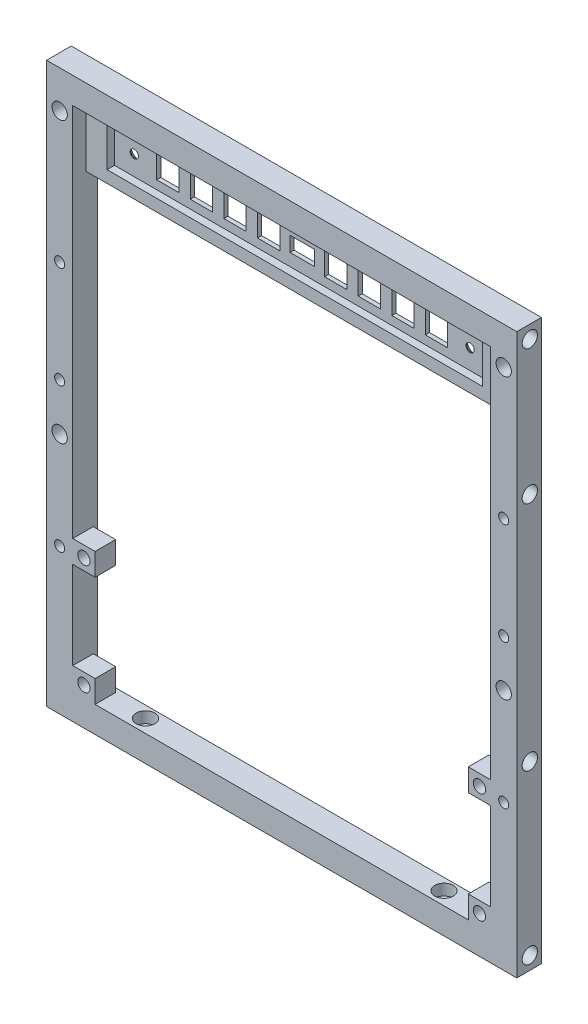
from build123d import *
from build123d.topology import SkipClean

# Parameters (mm, degrees)
SKETCH1_W                       = 126
SKETCH1_H                       = 150
SKETCH1_W_2                     = 112
SKETCH1_H_2                     = 136
BOSS_EXTRUDE1_DEPTH             = 7
SKETCH2_R                       = 2.05
CUT_EXTRUDE1_DEPTH              = 6
SKETCH3_R                       = 1.35
CUT_EXTRUDE2_DEPTH              = 157.419308271
SKETCH4_R                       = 2.5
CUT_EXTRUDE3_DEPTH              = 3
SKETCH5_R                       = 1.35
CUT_EXTRUDE4_DEPTH              = 99.198777996
SKETCH6_R                       = 2.5
CUT_EXTRUDE5_DEPTH              = 3
SKETCH7_R                       = 2.05
CUT_EXTRUDE6_DEPTH              = 99.198777996
CUT_EXTRUDE7_DEPTH              = 0.2
SKETCH9_W                       = 2.7
SKETCH9_H                       = 2.7
CUT_EXTRUDE8_DEPTH              = 0.2
SKETCH10_W                      = 6
SKETCH10_H                      = 6
BOSS_EXTRUDE2_DEPTH             = 5.5
SKETCH11_R                      = 1.65
CUT_EXTRUDE9_DEPTH              = 99.103261923
SKETCH12_W                      = 112
SKETCH12_H                      = 17
BOSS_EXTRUDE3_DEPTH             = 1.5
SKETCH13_W                      = 112
SKETCH13_H                      = 17
SKETCH13_W_2                    = 100.6
SKETCH13_H_2                    = 10.6
BOSS_EXTRUDE4_DEPTH             = 2
SKETCH14_W                      = 6
SKETCH14_H                      = 6
SKETCH14_W_2                    = 6.5
SKETCH14_H_2                    = 4
CUT_EXTRUDE10_DEPTH             = 99.103261923
SKETCH15_R                      = 1
BOSS_EXTRUDE5_DEPTH             = 2
CHAMFER1_SIZE                   = 0.4
CHAMFER2_SIZE                   = 0.4
CHAMFER3_SIZE                   = 0.4
SKETCH16_W                      = 6
SKETCH16_H                      = 6
BOSS_EXTRUDE7_DEPTH             = 5.5
SKETCH17_R                      = 1.65
CUT_EXTRUDE11_DEPTH             = 99.103261923
CUT_EXTRUDE12_DEPTH             = 99.103261923
CUT_EXTRUDE12_DEPTH_BACK        = 99.103261923
SKETCH18_R                      = 1.1
CHAMFER4_SIZE                   = 1.3
SKIZZE1_W                       = 112
SKIZZE1_H                       = 83.5
SCHNITT_LINEAR_AUSTRAGEN1_DEPTH = 5.5
SKIZZE2_W                       = 112
SKIZZE2_H                       = 3.2
SCHNITT_LINEAR_AUSTRAGEN2_DEPTH = 3.5


with BuildPart() as part:
    # Sketch1 → Boss-Extrude1 (new body)
    with BuildSketch(Plane.XY):
        Rectangle(SKETCH1_W, SKETCH1_H)
        Rectangle(SKETCH1_W_2, SKETCH1_H_2, mode=Mode.SUBTRACT)
    extrude(amount=BOSS_EXTRUDE1_DEPTH)

    # Sketch2 → Cut-Extrude1 (cut)
    with BuildSketch(Plane.ZY.offset(63)):
        with Locations((3.5, -71.5)):
            Circle(SKETCH2_R)
        with Locations((3.5, 71.5)):
            Circle(SKETCH2_R)
        with Locations((3.5, 35.5)):
            Circle(SKETCH2_R)
        with Locations((3.5, -26.5)):
            Circle(SKETCH2_R)
    cut_extrude1 = extrude(amount=-CUT_EXTRUDE1_DEPTH, mode=Mode.SUBTRACT)

    # Mirror1: Cut-Extrude1 across plane
    add(cut_extrude1.mirror(Plane(origin=(0, 0, 0), x_dir=(0, 0, 1), z_dir=(1, 0, 0))), mode=Mode.SUBTRACT)

    # Sketch3 → Cut-Extrude2 (cut, through all)
    with BuildSketch(Plane(origin=(0, -68, 0), x_dir=(1, 0, 0), z_dir=(0, 1, 0))):
        with Locations(Location((40, -3.5, 0), (0, 0, 270))):
            Circle(SKETCH3_R)
        with Locations(Location((-40, -3.5, 0), (0, 0, 270))):
            Circle(SKETCH3_R)
    extrude(amount=-CUT_EXTRUDE2_DEPTH, mode=Mode.SUBTRACT)

    # Sketch4 → Cut-Extrude3 (cut)
    with BuildSketch(Plane(origin=(0, -68, 0), x_dir=(1, 0, 0), z_dir=(0, 1, 0))):
        with Locations(Location((40, -3.5, 0), (0, 0, 270))):
            Circle(SKETCH4_R)
        with Locations(Location((-40, -3.5, 0), (0, 0, 270))):
            Circle(SKETCH4_R)
    extrude(amount=-CUT_EXTRUDE3_DEPTH, mode=Mode.SUBTRACT)

    # Sketch5 → Cut-Extrude4 (cut, through all)
    with BuildSketch(Plane(origin=(0, 0, 0), x_dir=(-1, 0, 0), z_dir=(0, 0, -1))):
        with Locations((-59.5, 2.6)):
            Circle(SKETCH5_R)
        with Locations(Location((59.5, 2.6, 0), (0, 0, 180))):
            Circle(SKETCH5_R)
        with Locations((-59.5, -36)):
            Circle(SKETCH5_R)
        with Locations(Location((59.5, -36, 0), (0, 0, 180))):
            Circle(SKETCH5_R)
        with Locations((-59.5, 29.9)):
            Circle(SKETCH5_R)
        with Locations(Location((59.5, 29.9, 0), (0, 0, 180))):
            Circle(SKETCH5_R)
    extrude(amount=-CUT_EXTRUDE4_DEPTH, mode=Mode.SUBTRACT)

    # Sketch6 → Cut-Extrude5 (cut)
    with BuildSketch(Plane(origin=(0, 0, 0), x_dir=(-1, 0, 0), z_dir=(0, 0, -1))):
        with Locations((-59.5, 2.6)):
            Circle(SKETCH6_R)
        with Locations((59.5, 2.6)):
            Circle(SKETCH6_R)
        with Locations((-59.5, -36)):
            Circle(SKETCH6_R)
        with Locations((59.5, -36)):
            Circle(SKETCH6_R)
        with Locations((-59.5, 29.9)):
            Circle(SKETCH6_R)
        with Locations((59.5, 29.9)):
            Circle(SKETCH6_R)
    extrude(amount=-CUT_EXTRUDE5_DEPTH, mode=Mode.SUBTRACT)

    # Sketch7 → Cut-Extrude6 (cut, through all)
    with BuildSketch(Plane(origin=(0, 0, 0), x_dir=(-1, 0, 0), z_dir=(0, 0, -1))):
        with Locations((-59.5, 65)):
            Circle(SKETCH7_R)
        with Locations((-59.5, -10)):
            Circle(SKETCH7_R)
    cut_extrude6 = extrude(amount=-CUT_EXTRUDE6_DEPTH, mode=Mode.SUBTRACT)

    # Mirror2: Cut-Extrude6 across plane
    add(cut_extrude6.mirror(Plane(origin=(0, 0, 0), x_dir=(0, 0, 1), z_dir=(1, 0, 0))), mode=Mode.SUBTRACT)

    # Sketch8 → Cut-Extrude7 (cut)
    with SkipClean():  # the faces are left unmerged after this step: merging them gives an invalid solid
        with BuildSketch(Plane(origin=(0, 0, 3), x_dir=(-1, 0, 0), z_dir=(0, 0, -1))):
            with BuildLine():
                Line((-60.85, 32.004162541), (-60.85, 27.795837459))
                ThreePointArc((-60.85, 27.795837459), (-59.5, 27.4), (-58.15, 27.795837459))
                Line((-58.15, 27.795837459), (-58.15, 32.004162541))
                ThreePointArc((-58.15, 32.004162541), (-59.5, 32.4), (-60.85, 32.004162541))
            make_face()
            with BuildLine():
                Line((-60.85, 0.495837459), (-60.85, 4.704162541))
                ThreePointArc((-60.85, 4.704162541), (-59.5, 5.1), (-58.15, 4.704162541))
                Line((-58.15, 4.704162541), (-58.15, 0.495837459))
                ThreePointArc((-58.15, 0.495837459), (-59.5, 0.1), (-60.85, 0.495837459))
            make_face()
            with BuildLine():
                Line((-60.85, -38.104162541), (-60.85, -33.895837459))
                ThreePointArc((-60.85, -33.895837459), (-59.5, -33.5), (-58.15, -33.895837459))
                Line((-58.15, -33.895837459), (-58.15, -38.104162541))
                ThreePointArc((-58.15, -38.104162541), (-59.5, -38.5), (-60.85, -38.104162541))
            make_face()
        cut_extrude7 = extrude(amount=-CUT_EXTRUDE7_DEPTH, mode=Mode.SUBTRACT)

    # Sketch9 → Cut-Extrude8 (cut)
    with SkipClean():  # the faces are left unmerged after this step: merging them gives an invalid solid
        with BuildSketch(Plane(origin=(0, 0, 3.2), x_dir=(-1, 0, 0), z_dir=(0, 0, -1))):
            with Locations((-59.5, 2.6)):
                Rectangle(SKETCH9_W, SKETCH9_H)
            with Locations((-59.5, -36)):
                Rectangle(SKETCH9_W, SKETCH9_H)
        cut_extrude8 = extrude(amount=-CUT_EXTRUDE8_DEPTH, mode=Mode.SUBTRACT)

    # Mirror3: Cut-Extrude7, Cut-Extrude8 across plane
    with SkipClean():  # the faces are left unmerged after this step: merging them gives an invalid solid
        add(cut_extrude7.mirror(Plane(origin=(0, 0, 0), x_dir=(0, 0, 1), z_dir=(1, 0, 0))), mode=Mode.SUBTRACT)
        add(cut_extrude8.mirror(Plane(origin=(0, 0, 0), x_dir=(0, 0, 1), z_dir=(1, 0, 0))), mode=Mode.SUBTRACT)

    # Sketch10 → Boss-Extrude2 (add)
    with SkipClean():  # the faces are left unmerged after this step: merging them gives an invalid solid
        with BuildSketch(Plane.XY.offset(7)):
            with Locations((53, -65)):
                Rectangle(SKETCH10_W, SKETCH10_H)
            with Locations((53, -35.5)):
                Rectangle(SKETCH10_W, SKETCH10_H)
        boss_extrude2 = extrude(amount=-BOSS_EXTRUDE2_DEPTH)

    # Sketch11 → Cut-Extrude9 (cut, through all)
    with SkipClean():  # the faces are left unmerged after this step: merging them gives an invalid solid
        with BuildSketch(Plane(origin=(0, 0, 1.5), x_dir=(-1, 0, 0), z_dir=(0, 0, -1))):
            with Locations((-53, -35.5)):
                Circle(SKETCH11_R)
            with Locations((-53, -65)):
                Circle(SKETCH11_R)
        cut_extrude9 = extrude(amount=-CUT_EXTRUDE9_DEPTH, mode=Mode.SUBTRACT)

    # Mirror4: Boss-Extrude2, Cut-Extrude9 across plane
    with SkipClean():  # the faces are left unmerged after this step: merging them gives an invalid solid
        add(boss_extrude2.mirror(Plane(origin=(0, 0, 0), x_dir=(0, 0, 1), z_dir=(1, 0, 0))))
        add(cut_extrude9.mirror(Plane(origin=(0, 0, 0), x_dir=(0, 0, 1), z_dir=(1, 0, 0))), mode=Mode.SUBTRACT)

    # Sketch12 → Boss-Extrude3 (add)
    with SkipClean():  # the faces are left unmerged after this step: merging them gives an invalid solid
        with BuildSketch(Plane(origin=(0, 0, 0), x_dir=(-1, 0, 0), z_dir=(0, 0, -1))):
            with Locations((0, 59.5)):
                Rectangle(SKETCH12_W, SKETCH12_H)
        extrude(amount=-BOSS_EXTRUDE3_DEPTH)

    # Sketch13 → Boss-Extrude4 (add)
    with SkipClean():  # the faces are left unmerged after this step: merging them gives an invalid solid
        with BuildSketch(Plane.XY.offset(1.5)):
            with Locations((0, 59.5)):
                Rectangle(SKETCH13_W, SKETCH13_H)
            with Locations((0, 59.5)):
                Rectangle(SKETCH13_W_2, SKETCH13_H_2, mode=Mode.SUBTRACT)
        extrude(amount=BOSS_EXTRUDE4_DEPTH)

    # Sketch14 → Cut-Extrude10 (cut, through all)
    with SkipClean():  # the faces are left unmerged after this step: merging them gives an invalid solid
        with BuildSketch(Plane.XY.offset(1.5)):
            with Locations((-36, 59.5)):
                Rectangle(SKETCH14_W, SKETCH14_H)
            with Locations((0, 59.5)):
                Rectangle(SKETCH14_W_2, SKETCH14_H_2)
            with Locations((9, 59.5)):
                Rectangle(SKETCH14_W, SKETCH14_H)
            with Locations((18, 59.5)):
                Rectangle(SKETCH14_W, SKETCH14_H)
            with Locations((27, 59.5)):
                Rectangle(SKETCH14_W, SKETCH14_H)
            with Locations((36, 59.5)):
                Rectangle(SKETCH14_W, SKETCH14_H)
            with Locations((-27, 59.5)):
                Rectangle(SKETCH14_W, SKETCH14_H)
            with Locations((-18, 59.5)):
                Rectangle(SKETCH14_W, SKETCH14_H)
            with Locations((-9, 59.5)):
                Rectangle(SKETCH14_W, SKETCH14_H)
        extrude(amount=-CUT_EXTRUDE10_DEPTH, mode=Mode.SUBTRACT)

    # Sketch15 → Boss-Extrude5 (add)
    with SkipClean():  # the faces are left unmerged after this step: merging them gives an invalid solid
        with BuildSketch(Plane.XY.offset(1.5)):
            with Locations(Location((-45, 59.5, 0), (0, 0, 180))):
                Circle(SKETCH15_R)
            with Locations(Location((45, 59.5, 0), (0, 0, 180))):
                Circle(SKETCH15_R)
        extrude(amount=BOSS_EXTRUDE5_DEPTH)

    # Chamfer1
    # the kernel refuses this chamfer: 0.4 mm, written as the material it takes off along each edge
    with BuildSketch(Plane(origin=(56, -68, 0), x_dir=(0.9996219169112968, 0, -0.02749587661058673), z_dir=(0, 1, 0)), Plane(origin=(-56, 51, 0), x_dir=(-0.9996219169112968, 0, -0.02749587661058673), z_dir=(0, -1, 0))) as chamfer1_piece_1:
        Polygon((CHAMFER1_SIZE * 0.999621916911, -CHAMFER1_SIZE * 0.0274958766106), (-CHAMFER1_SIZE * 0.0274958766106, -CHAMFER1_SIZE * 0.999621916911), (0, 0), align=None)
    extrude(amount=119, mode=Mode.SUBTRACT)
    with BuildSketch(Plane(origin=(-56, -68, 0), x_dir=(0, -0.9996219169112966, -0.027495876610585536), z_dir=(1, 0, 0))) as chamfer1_piece_2:
        Polygon((CHAMFER1_SIZE * 0.999621916911, -CHAMFER1_SIZE * 0.0274958766106), (-CHAMFER1_SIZE * 0.0274958766106, -CHAMFER1_SIZE * 0.999621916911), (0, 0), align=None)
    extrude(amount=112, mode=Mode.SUBTRACT)
    with BuildSketch(Plane(origin=(-56, 51, 0), x_dir=(0, 0.9996219169112968, -0.02749587661058673), z_dir=(1, 0, 0))) as chamfer1_piece_3:
        Polygon((CHAMFER1_SIZE * 0.999621916911, CHAMFER1_SIZE * 0.0274958766106), (-CHAMFER1_SIZE * 0.0274958766106, CHAMFER1_SIZE * 0.999621916911), (0, 0), align=None)
    extrude(amount=112, mode=Mode.SUBTRACT)
    with BuildSketch(Plane(origin=(-56, -68, 0), x_dir=(0, -0.9996219169112966, -0.027495876610585536), z_dir=(1, 0, 0))) as chamfer1_piece_4a_section:
        Polygon((CHAMFER1_SIZE * 0.999621916911, -CHAMFER1_SIZE * 0.0274958766106), (-CHAMFER1_SIZE * 0.0274958766106, -CHAMFER1_SIZE * 0.999621916911), (0, 0), align=None)
    chamfer1_piece_4a = extrude(amount=113.028673195, mode=Mode.PRIVATE)
    chamfer1_piece_4a = split(chamfer1_piece_4a, bisect_by=Plane(origin=(56, -68.131917451, 0.131917451), z_dir=(1, 0, 0)), keep=Keep.TOP, mode=Mode.PRIVATE)
    with BuildSketch(Plane(origin=(56, -69.028673195, 0), x_dir=(0.9996219169112968, 0, -0.02749587661058673), z_dir=(0, 1, 0))) as chamfer1_piece_4b_section:
        Polygon((CHAMFER1_SIZE * 0.999621916911, -CHAMFER1_SIZE * 0.0274958766106), (-CHAMFER1_SIZE * 0.0274958766106, -CHAMFER1_SIZE * 0.999621916911), (0, 0), align=None)
    chamfer1_piece_4b = extrude(amount=120.028673195, mode=Mode.PRIVATE)
    chamfer1_piece_4b = split(chamfer1_piece_4b, bisect_by=Plane(origin=(56.131917451, -68, 0.131917451), z_dir=(0, -1, 0)), keep=Keep.TOP, mode=Mode.PRIVATE)
    chamfer1_piece_4 = chamfer1_piece_4a & chamfer1_piece_4b
    add(chamfer1_piece_4, mode=Mode.SUBTRACT)
    with BuildSketch(Plane(origin=(56, -68, 0), x_dir=(0.9996219169112968, 0, -0.02749587661058673), z_dir=(0, 1, 0))) as chamfer1_piece_5a_section:
        Polygon((CHAMFER1_SIZE * 0.999621916911, -CHAMFER1_SIZE * 0.0274958766106), (-CHAMFER1_SIZE * 0.0274958766106, -CHAMFER1_SIZE * 0.999621916911), (0, 0), align=None)
    chamfer1_piece_5a = extrude(amount=120.028673195, mode=Mode.PRIVATE)
    chamfer1_piece_5a = split(chamfer1_piece_5a, bisect_by=Plane(origin=(56.131917451, 51, 0.131917451), z_dir=(0, 1, 0)), keep=Keep.TOP, mode=Mode.PRIVATE)
    with BuildSketch(Plane(origin=(-56, 51, 0), x_dir=(0, 0.9996219169112968, -0.02749587661058673), z_dir=(1, 0, 0))) as chamfer1_piece_5b_section:
        Polygon((CHAMFER1_SIZE * 0.999621916911, CHAMFER1_SIZE * 0.0274958766106), (-CHAMFER1_SIZE * 0.0274958766106, CHAMFER1_SIZE * 0.999621916911), (0, 0), align=None)
    chamfer1_piece_5b = extrude(amount=113.028673195, mode=Mode.PRIVATE)
    chamfer1_piece_5b = split(chamfer1_piece_5b, bisect_by=Plane(origin=(56, 51.131917451, 0.131917451), z_dir=(1, 0, 0)), keep=Keep.TOP, mode=Mode.PRIVATE)
    chamfer1_piece_5 = chamfer1_piece_5a & chamfer1_piece_5b
    add(chamfer1_piece_5, mode=Mode.SUBTRACT)
    with BuildSketch(Plane(origin=(-56, 51, 0), x_dir=(-0.9996219169112968, 0, -0.02749587661058673), z_dir=(0, -1, 0))) as chamfer1_piece_6a_section:
        Polygon((CHAMFER1_SIZE * 0.999621916911, -CHAMFER1_SIZE * 0.0274958766106), (-CHAMFER1_SIZE * 0.0274958766106, -CHAMFER1_SIZE * 0.999621916911), (0, 0), align=None)
    chamfer1_piece_6a = extrude(amount=120.028673195, mode=Mode.PRIVATE)
    chamfer1_piece_6a = split(chamfer1_piece_6a, bisect_by=Plane(origin=(-56.131917451, -68, 0.131917451), z_dir=(0, -1, 0)), keep=Keep.TOP, mode=Mode.PRIVATE)
    with BuildSketch(Plane(origin=(-57.028673195, -68, 0), x_dir=(0, -0.9996219169112966, -0.027495876610585536), z_dir=(1, 0, 0))) as chamfer1_piece_6b_section:
        Polygon((CHAMFER1_SIZE * 0.999621916911, -CHAMFER1_SIZE * 0.0274958766106), (-CHAMFER1_SIZE * 0.0274958766106, -CHAMFER1_SIZE * 0.999621916911), (0, 0), align=None)
    chamfer1_piece_6b = extrude(amount=113.028673195, mode=Mode.PRIVATE)
    chamfer1_piece_6b = split(chamfer1_piece_6b, bisect_by=Plane(origin=(-56, -68.131917451, 0.131917451), z_dir=(-1, 0, 0)), keep=Keep.TOP, mode=Mode.PRIVATE)
    chamfer1_piece_6 = chamfer1_piece_6a & chamfer1_piece_6b
    add(chamfer1_piece_6, mode=Mode.SUBTRACT)
    with BuildSketch(Plane(origin=(-56, 52.028673195, 0), x_dir=(-0.9996219169112968, 0, -0.02749587661058673), z_dir=(0, -1, 0))) as chamfer1_piece_7a_section:
        Polygon((CHAMFER1_SIZE * 0.999621916911, -CHAMFER1_SIZE * 0.0274958766106), (-CHAMFER1_SIZE * 0.0274958766106, -CHAMFER1_SIZE * 0.999621916911), (0, 0), align=None)
    chamfer1_piece_7a = extrude(amount=120.028673195, mode=Mode.PRIVATE)
    chamfer1_piece_7a = split(chamfer1_piece_7a, bisect_by=Plane(origin=(-56.131917451, 51, 0.131917451), z_dir=(0, 1, 0)), keep=Keep.TOP, mode=Mode.PRIVATE)
    with BuildSketch(Plane(origin=(-57.028673195, 51, 0), x_dir=(0, 0.9996219169112968, -0.02749587661058673), z_dir=(1, 0, 0))) as chamfer1_piece_7b_section:
        Polygon((CHAMFER1_SIZE * 0.999621916911, CHAMFER1_SIZE * 0.0274958766106), (-CHAMFER1_SIZE * 0.0274958766106, CHAMFER1_SIZE * 0.999621916911), (0, 0), align=None)
    chamfer1_piece_7b = extrude(amount=113.028673195, mode=Mode.PRIVATE)
    chamfer1_piece_7b = split(chamfer1_piece_7b, bisect_by=Plane(origin=(-56, 51.131917451, 0.131917451), z_dir=(-1, 0, 0)), keep=Keep.TOP, mode=Mode.PRIVATE)
    chamfer1_piece_7 = chamfer1_piece_7a & chamfer1_piece_7b
    add(chamfer1_piece_7, mode=Mode.SUBTRACT)

    # Chamfer2
    chamfer2_edges = [part.edges().sort_by_distance(p)[0] for p in [
        (0, -75, 0),
        (-63, 0, 0),
        (0, 75, 0),
        (63, 0, 0),
    ]]
    chamfer(chamfer2_edges, length=CHAMFER2_SIZE)

    # Chamfer3
    chamfer3_edges = [part.edges().sort_by_distance(p)[0] for p in [
        (-6, 59.5, 0),
        (-9, 56.5, 0),
        (-12, 59.5, 0),
        (-9, 62.5, 0),
        (-15, 59.5, 0),
        (-18, 56.5, 0),
        (-21, 59.5, 0),
        (-18, 62.5, 0),
        (-24, 59.5, 0),
        (-27, 56.5, 0),
        (-30, 59.5, 0),
        (-27, 62.5, 0),
        (-33, 59.5, 0),
        (-36, 56.5, 0),
        (-39, 59.5, 0),
        (-36, 62.5, 0),
        (39, 59.5, 0),
        (36, 56.5, 0),
        (33, 59.5, 0),
        (36, 62.5, 0),
        (30, 59.5, 0),
        (27, 56.5, 0),
        (24, 59.5, 0),
        (27, 62.5, 0),
        (21, 59.5, 0),
        (18, 56.5, 0),
        (15, 59.5, 0),
        (18, 62.5, 0),
        (12, 59.5, 0),
        (9, 56.5, 0),
        (6, 59.5, 0),
        (9, 62.5, 0),
        (3.25, 59.5, 0),
        (0, 57.5, 0),
        (-3.25, 59.5, 0),
        (0, 61.5, 0),
    ]]
    chamfer(chamfer3_edges, length=CHAMFER3_SIZE)

    # Sketch16 → Boss-Extrude7 (add)
    with BuildSketch(Plane.XY.offset(7)):
        Polygon((-50, 51), (-50, 54.2), (-56, 54.2), (-56, 51), (-56, 45), (-50, 45), align=None)
        with Locations((-53, -29.5)):
            Rectangle(SKETCH16_W, SKETCH16_H)
        with Locations((53, -29.5)):
            Rectangle(SKETCH16_W, SKETCH16_H)
        Polygon((56, 51), (56, 45), (50, 45), (50, 51), (50, 54.2), (56, 54.2), align=None)
    extrude(amount=-BOSS_EXTRUDE7_DEPTH)

    # Sketch17 → Cut-Extrude11 (cut, through all)
    with BuildSketch(Plane(origin=(0, 0, 1.5), x_dir=(-1, 0, 0), z_dir=(0, 0, -1))):
        with Locations((-53, -29.5)):
            Circle(SKETCH17_R)
        with Locations((53, -29.5)):
            Circle(SKETCH17_R)
        with Locations((53, 48)):
            Circle(SKETCH17_R)
        with Locations((-53, 48)):
            Circle(SKETCH17_R)
    extrude(amount=-CUT_EXTRUDE11_DEPTH, mode=Mode.SUBTRACT)

    # Sketch18 → Cut-Extrude12 (cut, two sides: drawn at the far end of the back side and taken through both)
    with BuildSketch(Plane.XY.offset(1.5).offset(-CUT_EXTRUDE12_DEPTH_BACK)):
        with Locations((-45, 59.5)):
            Circle(SKETCH18_R)
        with Locations((45, 59.5)):
            Circle(SKETCH18_R)
    extrude(amount=CUT_EXTRUDE12_DEPTH + CUT_EXTRUDE12_DEPTH_BACK, mode=Mode.SUBTRACT)

    # Chamfer4
    chamfer4_edges = [part.edges().sort_by_distance(p)[0] for p in [
        (-46.1, 59.5, 0),
        (43.9, 59.5, 0),
    ]]
    chamfer(chamfer4_edges, length=CHAMFER4_SIZE)

    # Skizze1 → Schnitt-Linear austragen1 (cut)
    with BuildSketch(Plane.XY.offset(7)):
        with Locations((0, 9.25)):
            Rectangle(SKIZZE1_W, SKIZZE1_H)
    extrude(amount=-SCHNITT_LINEAR_AUSTRAGEN1_DEPTH, mode=Mode.SUBTRACT)

    # Skizze2 → Schnitt-Linear austragen2 (cut)
    with BuildSketch(Plane.XY.offset(7)):
        with Locations((0, 52.6)):
            Rectangle(SKIZZE2_W, SKIZZE2_H)
    extrude(amount=-SCHNITT_LINEAR_AUSTRAGEN2_DEPTH, mode=Mode.SUBTRACT)


solid = part.part
